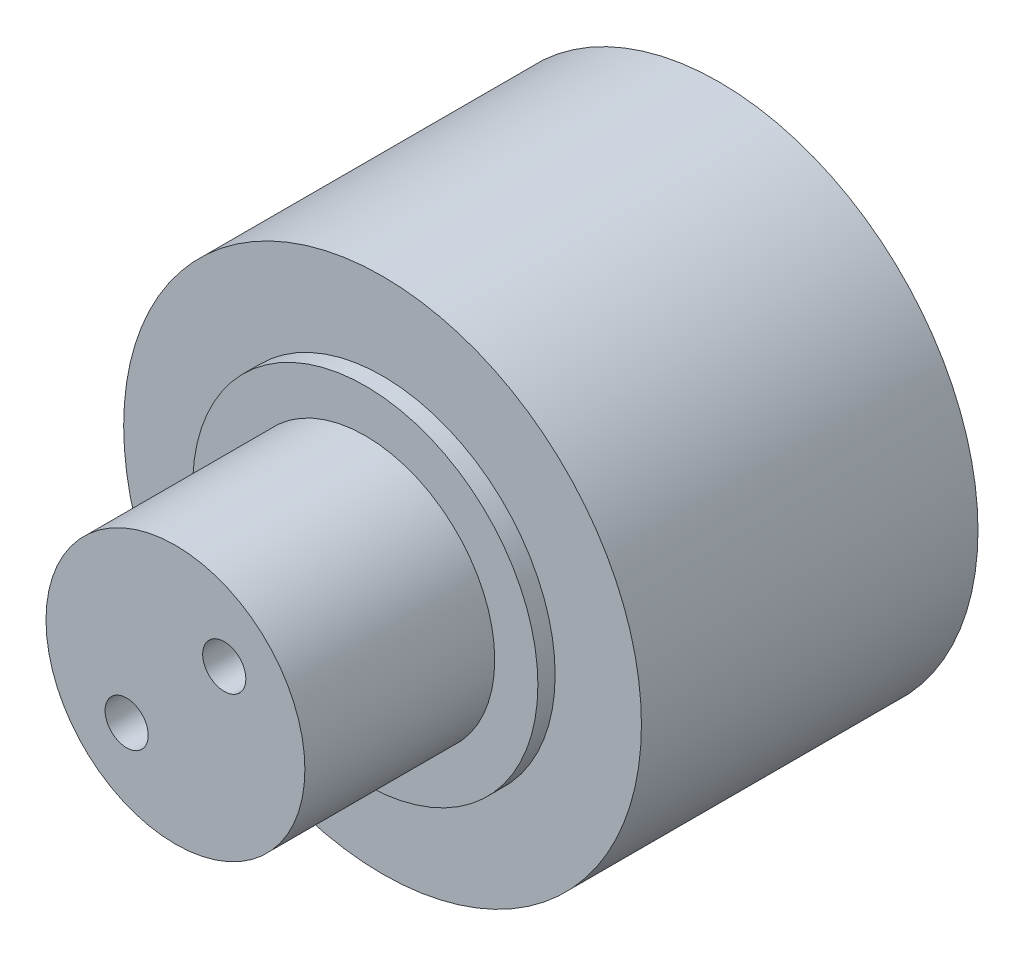
from build123d import *

# Parameters (mm, degrees)
SKETCH_1_R      = 15
EXTRUDE_1_DEPTH = 19.5
SKETCH_2_R      = 10
EXTRUDE_2_DEPTH = 1
SKETCH_3_R      = 7.5
EXTRUDE_3_DEPTH = 11
M3X0_52_D       = 2.5
M3X0_52_DEPTH   = 12.5
M3X0_52_TIP     = 0.751075774
M3X0_51_D       = 2.5
M3X0_51_DEPTH   = 8
M3X0_51_TIP     = 0.751075774


with BuildPart() as part:
    # Эскиз1 → Бобышка-Вытянуть1 (new body)
    with BuildSketch(Plane.XY):
        Circle(SKETCH_1_R)
    extrude(amount=EXTRUDE_1_DEPTH)

    # Эскиз2 → Бобышка-Вытянуть2 (add)
    with BuildSketch(Plane.XY.offset(19.5)):
        Circle(SKETCH_2_R)
    extrude(amount=EXTRUDE_2_DEPTH)

    # Эскиз3 → Бобышка-Вытянуть3 (add)
    with BuildSketch(Plane.XY.offset(20.5)):
        Circle(SKETCH_3_R)
    extrude(amount=EXTRUDE_3_DEPTH)

    # Отверстие обработанное метчиком M3x0.52
    with Locations(Plane(origin=(0, 0, 0), x_dir=(-1, 0, 0), z_dir=(0, 0, -1))):
        with Locations((0, 10), (10, 0), (-10, 0), (0, -10)):
            Hole(M3X0_52_D / 2, depth=M3X0_52_DEPTH)
            with Locations((0, 0, -(M3X0_52_DEPTH + M3X0_52_TIP / 2))):  # 118° drill point
                Cone(0, M3X0_52_D / 2, M3X0_52_TIP, mode=Mode.SUBTRACT)

    # Отверстие обработанное метчиком M3x0.51
    with Locations(Plane.XY.offset(31.5)):
        with Locations((-2.828427125, -2.828427125), (2.828427125, 2.828427125)):
            Hole(M3X0_51_D / 2, depth=M3X0_51_DEPTH)
            with Locations((0, 0, -(M3X0_51_DEPTH + M3X0_51_TIP / 2))):  # 118° drill point
                Cone(0, M3X0_51_D / 2, M3X0_51_TIP, mode=Mode.SUBTRACT)


solid = part.part
